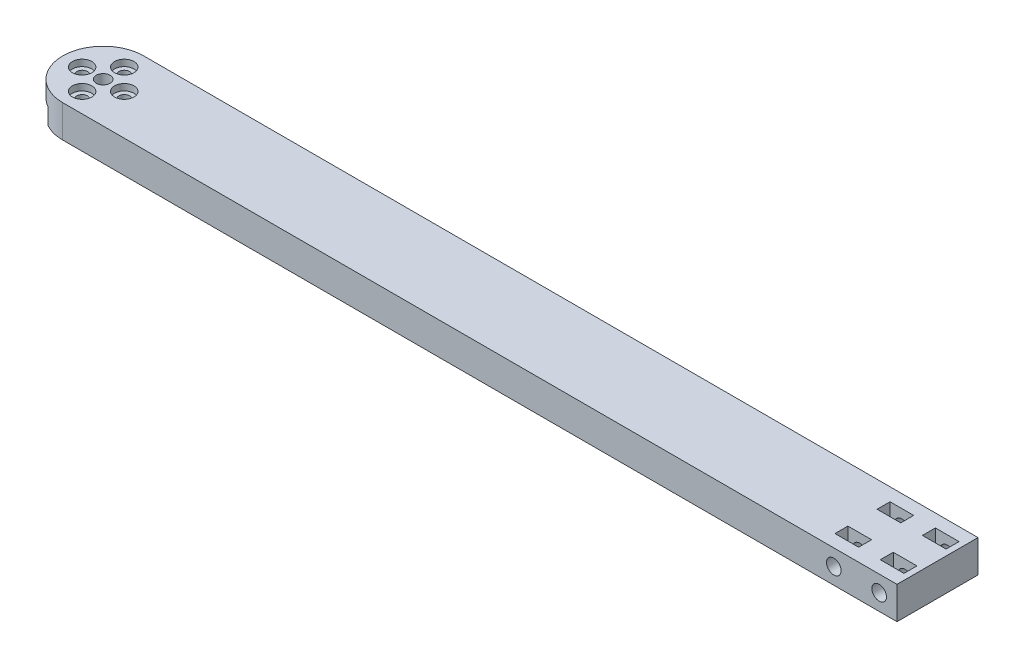
from build123d import *

# Parameters (mm, degrees)
SKETCH1_W              = 270
SKETCH1_H              = 25
BOSS_EXTRUDE1_DEPTH    = 10
CUT_EXTRUDE1_REACH     = 273.339
SKETCH2_R              = 2.15
FILLET1_R              = 12.5
SKETCH3_R              = 2.25
CUT_EXTRUDE2_DEPTH     = 272.339271024
CUT_EXTRUDE5_REACH     = 273.339
SKETCH5_W              = 7.3
SKETCH5_H              = 4
SKETCH6_R              = 10
CUT_EXTRUDE6_DEPTH     = 5
CUT_EXTRUDE7_REACH     = 273.201
SKETCH7_R              = 1.65
CUT_EXTRUDE8_START     = -3.2
CUT_EXTRUDE8_OUTLINE_W = 6
CUT_EXTRUDE8_OUTLINE_H = 6
CUT_EXTRUDE8_DEPTH     = 6.4
SKETCH9_R              = 3
CUT_EXTRUDE9_DEPTH     = 2


# Read off the part's stored shape, not the designer's step: Cut-Extrude8
with BuildPart() as part:
    # Sketch1 → Boss-Extrude1 (new body)
    with BuildSketch(Plane(origin=(0, 0, 0), x_dir=(1, 0, 0), z_dir=(0, 1, 0))):
        with Locations((135, 12.5)):
            Rectangle(SKETCH1_W, SKETCH1_H)
    extrude(amount=BOSS_EXTRUDE1_DEPTH)

    # Sketch2 → Cut-Extrude1 (cut, up to next)
    with BuildSketch(Plane(origin=(0, 10, 0), x_dir=(1, 0, 0), z_dir=(0, 1, 0)), mode=Mode.PRIVATE) as cut_extrude1_sk1:
        with Locations(Location((12.5, 12.5, 0), (0, 0, 270))):
            Circle(SKETCH2_R)
    cut_extrude1_tool1 = extrude(cut_extrude1_sk1.sketch, amount=-CUT_EXTRUDE1_REACH, mode=Mode.PRIVATE) & part.part
    add(cut_extrude1_tool1.solids().sort_by_distance((12.5, 10, -12.5))[0], mode=Mode.SUBTRACT)

    # Fillet1
    fillet1_edges = [part.edges().sort_by_distance(p)[0] for p in [
        (0, 5, 0),
        (0, 5, -25),
    ]]
    fillet(fillet1_edges, radius=FILLET1_R - 0.0001)  # a hair under: the kernel refuses the full size

    # Sketch3 → Cut-Extrude2 (cut, through all)
    with BuildSketch(Plane(origin=(0, 0, -25), x_dir=(-1, 0, 0), z_dir=(0, 0, -1))):
        with Locations((-264.5, 5)):
            Circle(SKETCH3_R)
        with Locations((-250.5, 5)):
            Circle(SKETCH3_R)
    extrude(amount=-CUT_EXTRUDE2_DEPTH, mode=Mode.SUBTRACT)

    # Sketch5 → Cut-Extrude5 (cut, up to next)
    with BuildSketch(Plane(origin=(0, 10, 0), x_dir=(1, 0, 0), z_dir=(0, 1, 0)), mode=Mode.PRIVATE) as cut_extrude5_sk1:
        with Locations((264.5, 19)):
            Rectangle(SKETCH5_W, SKETCH5_H)
    cut_extrude5_tool1 = extrude(cut_extrude5_sk1.sketch, amount=-CUT_EXTRUDE5_REACH, mode=Mode.PRIVATE) & part.part
    # Sketch5 → Cut-Extrude5 (cut, up to next)
    with BuildSketch(Plane(origin=(0, 10, 0), x_dir=(1, 0, 0), z_dir=(0, 1, 0)), mode=Mode.PRIVATE) as cut_extrude5_sk2:
        with Locations((264.5, 6)):
            Rectangle(SKETCH5_W, SKETCH5_H)
    cut_extrude5_tool2 = extrude(cut_extrude5_sk2.sketch, amount=-CUT_EXTRUDE5_REACH, mode=Mode.PRIVATE) & part.part
    # Sketch5 → Cut-Extrude5 (cut, up to next)
    with BuildSketch(Plane(origin=(0, 10, 0), x_dir=(1, 0, 0), z_dir=(0, 1, 0)), mode=Mode.PRIVATE) as cut_extrude5_sk3:
        with Locations((250.5, 19)):
            Rectangle(SKETCH5_W, SKETCH5_H)
    cut_extrude5_tool3 = extrude(cut_extrude5_sk3.sketch, amount=-CUT_EXTRUDE5_REACH, mode=Mode.PRIVATE) & part.part
    # Sketch5 → Cut-Extrude5 (cut, up to next)
    with BuildSketch(Plane(origin=(0, 10, 0), x_dir=(1, 0, 0), z_dir=(0, 1, 0)), mode=Mode.PRIVATE) as cut_extrude5_sk4:
        with Locations((250.5, 6)):
            Rectangle(SKETCH5_W, SKETCH5_H)
    cut_extrude5_tool4 = extrude(cut_extrude5_sk4.sketch, amount=-CUT_EXTRUDE5_REACH, mode=Mode.PRIVATE) & part.part
    add(cut_extrude5_tool1.solids().sort_by_distance((264.5, 10, -19))[0], mode=Mode.SUBTRACT)
    add(cut_extrude5_tool2.solids().sort_by_distance((264.5, 10, -6))[0], mode=Mode.SUBTRACT)
    add(cut_extrude5_tool3.solids().sort_by_distance((250.5, 10, -19))[0], mode=Mode.SUBTRACT)
    add(cut_extrude5_tool4.solids().sort_by_distance((250.5, 10, -6))[0], mode=Mode.SUBTRACT)

    # Sketch6 → Cut-Extrude6 (cut)
    with BuildSketch(Plane.XZ):
        with Locations(Location((12.5, -12.5, 0), (0, 0, 270))):
            Circle(SKETCH6_R)
    extrude(amount=-CUT_EXTRUDE6_DEPTH, mode=Mode.SUBTRACT)

    # Sketch7 → Cut-Extrude7 (cut, up to next)
    with BuildSketch(Plane.XZ.offset(-5), mode=Mode.PRIVATE) as cut_extrude7_sk1:
        with Locations(Location((12.5, -6, 0), (0, 0, 270))):
            Circle(SKETCH7_R)
    cut_extrude7_tool1 = extrude(cut_extrude7_sk1.sketch, amount=-CUT_EXTRUDE7_REACH, mode=Mode.PRIVATE) & part.part
    # Sketch7 → Cut-Extrude7 (cut, up to next)
    with BuildSketch(Plane.XZ.offset(-5), mode=Mode.PRIVATE) as cut_extrude7_sk2:
        with Locations(Location((19, -12.5, 0), (0, 0, 270))):
            Circle(SKETCH7_R)
    cut_extrude7_tool2 = extrude(cut_extrude7_sk2.sketch, amount=-CUT_EXTRUDE7_REACH, mode=Mode.PRIVATE) & part.part
    # Sketch7 → Cut-Extrude7 (cut, up to next)
    with BuildSketch(Plane.XZ.offset(-5), mode=Mode.PRIVATE) as cut_extrude7_sk3:
        with Locations(Location((12.5, -19, 0), (0, 0, 270))):
            Circle(SKETCH7_R)
    cut_extrude7_tool3 = extrude(cut_extrude7_sk3.sketch, amount=-CUT_EXTRUDE7_REACH, mode=Mode.PRIVATE) & part.part
    # Sketch7 → Cut-Extrude7 (cut, up to next)
    with BuildSketch(Plane.XZ.offset(-5), mode=Mode.PRIVATE) as cut_extrude7_sk4:
        with Locations(Location((6, -12.5, 0), (0, 0, 270))):
            Circle(SKETCH7_R)
    cut_extrude7_tool4 = extrude(cut_extrude7_sk4.sketch, amount=-CUT_EXTRUDE7_REACH, mode=Mode.PRIVATE) & part.part
    add(cut_extrude7_tool1.solids().sort_by_distance((12.5, 5, -6))[0], mode=Mode.SUBTRACT)
    add(cut_extrude7_tool2.solids().sort_by_distance((19, 5, -12.5))[0], mode=Mode.SUBTRACT)
    add(cut_extrude7_tool3.solids().sort_by_distance((12.5, 5, -19))[0], mode=Mode.SUBTRACT)
    add(cut_extrude7_tool4.solids().sort_by_distance((6, 5, -12.5))[0], mode=Mode.SUBTRACT)

    # Cut-Extrude8 outline → Cut-Extrude8 (cut)
    with BuildSketch(Plane(origin=(0, 0, 0), x_dir=(0.707106781186548, 0, -0.707106781186547), z_dir=(0.707106781186547, 0, 0.707106781186548)).offset(CUT_EXTRUDE8_START)):
        with Locations((7, 2)):
            Rectangle(CUT_EXTRUDE8_OUTLINE_W, CUT_EXTRUDE8_OUTLINE_H)
    extrude(amount=CUT_EXTRUDE8_DEPTH, mode=Mode.SUBTRACT)

    # Sketch9 → Cut-Extrude9 (cut)
    with BuildSketch(Plane(origin=(0, 10, 0), x_dir=(1, 0, 0), z_dir=(0, 1, 0))):
        with Locations(Location((12.5, 19, 0), (0, 0, 270))):
            Circle(SKETCH9_R)
        with Locations(Location((19, 12.5, 0), (0, 0, 270))):
            Circle(SKETCH9_R)
        with Locations(Location((12.5, 6, 0), (0, 0, 270))):
            Circle(SKETCH9_R)
        with Locations(Location((6, 12.5, 0), (0, 0, 270))):
            Circle(SKETCH9_R)
    extrude(amount=-CUT_EXTRUDE9_DEPTH, mode=Mode.SUBTRACT)


solid = part.part
